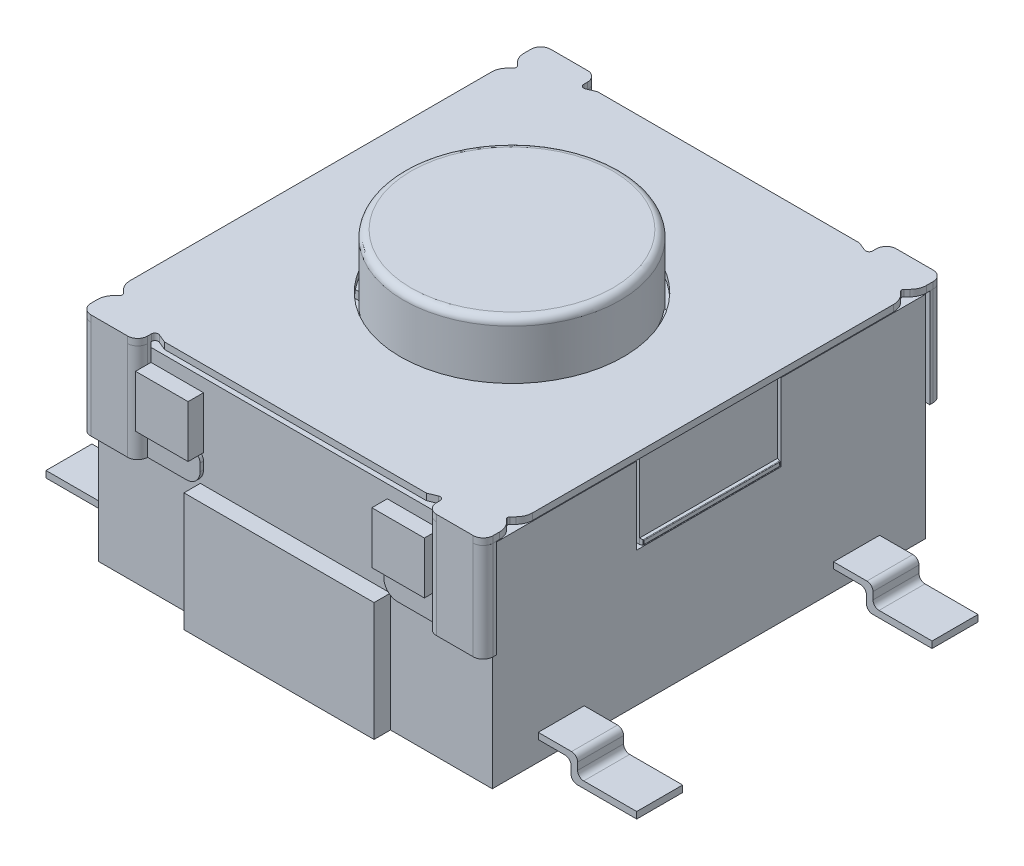
from build123d import *

# Parameters (mm, degrees)
SALIENTE_EXTRUIR1_DEPTH       = 5.2
CROQUIS2_W                    = 9
CROQUIS2_H                    = 3.8
CORTAR_EXTRUIR1_DEPTH         = 5.2
SALIENTE_EXTRUIR2_DEPTH       = 0.3
SALIENTE_EXTRUIR2_DEPTH_BACK  = 3
CROQUIS3_W                    = 6
CROQUIS3_H                    = 6.6
CROQUIS4_R                    = 1.65
CORTAR_EXTRUIR2_DEPTH         = 1.3
SALIENTE_EXTRUIR3_DEPTH       = 0.1
CROQUIS6_R                    = 1.7
CORTAR_EXTRUIR3_DEPTH         = 0.1
CORTAR_EXTRUIR4_DEPTH         = 7.1
CROQUIS9_W                    = 2.099652297
CROQUIS9_H                    = 0.087166241
SALIENTE_EXTRUIR4_DEPTH       = 0.05
SALIENTE_EXTRUIR4_TAPER       = 10
REDONDEO1_R                   = 0.01
CROQUIS10_W                   = 2.099652297
CROQUIS10_H                   = 0.106155941
SALIENTE_EXTRUIR5_DEPTH       = 0.05
SALIENTE_EXTRUIR5_TAPER       = 10
REDONDEO2_R                   = 0.01
SALIENTE_EXTRUIR6_DEPTH       = 1.5
CROQUIS12_W                   = 0.052583555
CROQUIS12_H                   = 0.43471288
SALIENTE_EXTRUIR7_DEPTH       = 0.8
REDONDEO4_R                   = 0.21
REDONDEO5_R                   = 0.11
CROQUIS13_W                   = 0.052583555
CROQUIS13_H                   = 0.428873363
SALIENTE_EXTRUIR8_DEPTH       = 0.8
REDONDEO6_R                   = 0.21
REDONDEO7_R                   = 0.11
CROQUIS14_W                   = 0.052583555
CROQUIS14_H                   = 0.428972682
SALIENTE_EXTRUIR9_DEPTH       = 0.8
REDONDEO8_R                   = 0.21
REDONDEO9_R                   = 0.11
CROQUIS15_W                   = 0.051174265
CROQUIS15_H                   = 0.43615012
SALIENTE_EXTRUIR10_DEPTH      = 0.8
REDONDEO10_R                  = 0.11
REDONDEO11_R                  = 0.21
SALIENTE_EXTRUIR11_DEPTH      = 0.23
SALIENTE_EXTRUIR11_DEPTH_BACK = 6.835
CROQUIS16_W                   = 0.8
CROQUIS16_H                   = 0.791126244
SALIENTE_EXTRUIR12_DEPTH      = 0.23
SALIENTE_EXTRUIR12_DEPTH_BACK = 6.85
CROQUIS17_W                   = 2.89647861
CROQUIS17_H                   = 1.806507962
CROQUIS18_R                   = 1.65
CORTAR_EXTRUIR5_DEPTH         = 2.23
CROQUIS19_R                   = 1.65
SALIENTE_EXTRUIR13_DEPTH      = 2.23
REDONDEO12_R                  = 0.11


with BuildPart() as part:
    # Croquis1 → Saliente-Extruir1 (new body)
    with BuildSketch(Plane.XY):
        with BuildLine():
            Line((0, 0), (0.907509214, 0))
            ThreePointArc((0.907509214, 0), (0.972910076, 0.027089924), (1, 0.092490786))
            Line((1, 0.092490786), (1, 0.20688219))
            ThreePointArc((1, 0.20688219), (1.027089924, 0.272283052), (1.092490786, 0.299372976))
            Line((1.092490786, 0.299372976), (7.907509214, 0.299372976))
            ThreePointArc((7.907509214, 0.299372976), (7.972910076, 0.272283052), (8, 0.20688219))
            Line((8, 0.20688219), (8, 0.092490786))
            ThreePointArc((8, 0.092490786), (8.027089924, 0.027089924), (8.092490786, 0))
            Line((8.092490786, 0), (9, 0))
            Line((9, 0), (9, 0.1))
            Line((9, 0.1), (8.192490786, 0.1))
            ThreePointArc((8.192490786, 0.1), (8.127089924, 0.127089924), (8.1, 0.192490786))
            Line((8.1, 0.192490786), (8.1, 0.299372976))
            Line((8.1, 0.299372976), (8.1, 0.30214365))
            ThreePointArc((8.1, 0.30214365), (8.072910076, 0.367544511), (8.007509214, 0.394634435))
            Line((8.007509214, 0.394634435), (0.992490786, 0.394634435))
            ThreePointArc((0.992490786, 0.394634435), (0.927089924, 0.367544511), (0.9, 0.30214365))
            Line((0.9, 0.30214365), (0.9, 0.299372976))
            Line((0.9, 0.299372976), (0.9, 0.192490786))
            ThreePointArc((0.9, 0.192490786), (0.872910076, 0.127089924), (0.807509214, 0.1))
            Line((0.807509214, 0.1), (0, 0.1))
            Line((0, 0.1), (0, 0))
        make_face()
    extrude(amount=SALIENTE_EXTRUIR1_DEPTH)

    # Croquis2 → Cortar-Extruir1 (cut)
    with BuildSketch(Plane(origin=(0, 0.394634435, 0), x_dir=(1, 0, 0), z_dir=(0, 1, 0))):
        with Locations((4.5, -2.6)):
            Rectangle(CROQUIS2_W, CROQUIS2_H)
    extrude(amount=-CORTAR_EXTRUIR1_DEPTH, mode=Mode.SUBTRACT)


with BuildPart() as cortar_extruir1_piece_1:
    # of the separate pieces the step leaves, piece 1, a body of its own (cortar_extruir1_pieces)
    add(part.part.solids().sort_by_distance((0.9, 0.30214365, 4.5))[0])



with BuildPart() as cortar_extruir1_piece_2:
    # of the separate pieces the step leaves, piece 2, a body of its own (cortar_extruir1_pieces)
    add(part.part.solids().sort_by_distance((0.992490786, 0.394634435, 0))[0])


with BuildPart() as cortar_extruir1_piece_1_1:
    add(cortar_extruir1_piece_1.part)

    add(cortar_extruir1_piece_2.part)  # Saliente-Extruir2 merges Cortar-Extruir1 piece 2
    # Croquis3 → Saliente-Extruir2 (add, two sides: drawn at the far end of the back side and taken through both)
    with BuildSketch(Plane.XZ.offset(-0.299372976).offset(-SALIENTE_EXTRUIR2_DEPTH_BACK)):
        with Locations((4.5, 2.6)):
            Rectangle(CROQUIS3_W, CROQUIS3_H)
    extrude(amount=SALIENTE_EXTRUIR2_DEPTH + SALIENTE_EXTRUIR2_DEPTH_BACK)

    # Croquis4 → Cortar-Extruir2 (cut)
    with BuildSketch(Plane(origin=(0, 3.299372976, 0), x_dir=(1, 0, 0), z_dir=(0, 1, 0))):
        with Locations(Location((4.5, -2.6, 0), (0, 0, 270))):
            Circle(CROQUIS4_R)
    extrude(amount=-CORTAR_EXTRUIR2_DEPTH, mode=Mode.SUBTRACT)

    # Croquis5 → Saliente-Extruir3 (add)
    with BuildSketch(Plane(origin=(0, 3.299372976, 0), x_dir=(1, 0, 0), z_dir=(0, 1, 0))):
        with BuildLine():
            Line((2.504716132, -5.9), (2.373359986, -5.845328176))
            ThreePointArc((2.373359986, -5.845328176), (2.323590515, -5.850165849), (2.3, -5.894255427))
            Line((2.3, -5.894255427), (2.3, -5.951019444))
            ThreePointArc((2.3, -5.951019444), (2.255390439, -6.058716451), (2.147693433, -6.103326011))
            Line((2.147693433, -6.103326011), (1.587427805, -6.103326011))
            ThreePointArc((1.587427805, -6.103326011), (1.479730799, -6.058716451), (1.435121238, -5.951019444))
            Line((1.435121238, -5.951019444), (1.435121238, -5.852924356))
            ThreePointArc((1.435121238, -5.852924356), (1.454499263, -5.755504449), (1.509683207, -5.672915841))
            Line((1.509683207, -5.672915841), (1.553576638, -5.629022409))
            ThreePointArc((1.553576638, -5.629022409), (1.564925448, -5.60162396), (1.553576638, -5.574225511))
            Line((1.553576638, -5.574225511), (1.509683207, -5.530332079))
            ThreePointArc((1.509683207, -5.530332079), (1.454499263, -5.44774347), (1.435121238, -5.350323564))
            Line((1.435121238, -5.350323564), (1.435121238, -3.103211445))
            Line((1.435121238, -3.103211445), (1.435121238, -2.096788555))
            Line((1.435121238, -2.096788555), (1.435121238, 0.150323564))
            ThreePointArc((1.435121238, 0.150323564), (1.454499263, 0.24774347), (1.509683207, 0.330332079))
            Line((1.509683207, 0.330332079), (1.553576638, 0.374225511))
            ThreePointArc((1.553576638, 0.374225511), (1.564925448, 0.40162396), (1.553576638, 0.429022409))
            Line((1.553576638, 0.429022409), (1.509683207, 0.472915841))
            ThreePointArc((1.509683207, 0.472915841), (1.454499263, 0.555504449), (1.435121238, 0.652924356))
            Line((1.435121238, 0.652924356), (1.435121238, 0.751019444))
            ThreePointArc((1.435121238, 0.751019444), (1.479730799, 0.858716451), (1.587427805, 0.903326011))
            Line((1.587427805, 0.903326011), (2.147693433, 0.903326011))
            ThreePointArc((2.147693433, 0.903326011), (2.255390439, 0.858716451), (2.3, 0.751019444))
            Line((2.3, 0.751019444), (2.3, 0.694255427))
            ThreePointArc((2.3, 0.694255427), (2.323590515, 0.650165849), (2.373359986, 0.645328176))
            Line((2.373359986, 0.645328176), (2.504716132, 0.7))
            Line((2.504716132, 0.7), (6.495283868, 0.7))
            Line((6.495283868, 0.7), (6.626640014, 0.645328176))
            ThreePointArc((6.626640014, 0.645328176), (6.676409485, 0.650165849), (6.7, 0.694255427))
            Line((6.7, 0.694255427), (6.7, 0.751019444))
            ThreePointArc((6.7, 0.751019444), (6.744609561, 0.858716451), (6.852306567, 0.903326011))
            Line((6.852306567, 0.903326011), (7.412572195, 0.903326011))
            ThreePointArc((7.412572195, 0.903326011), (7.520269201, 0.858716451), (7.564878762, 0.751019444))
            Line((7.564878762, 0.751019444), (7.564878762, 0.652924356))
            ThreePointArc((7.564878762, 0.652924356), (7.545500737, 0.555504449), (7.490316793, 0.472915841))
            Line((7.490316793, 0.472915841), (7.446423362, 0.429022409))
            ThreePointArc((7.446423362, 0.429022409), (7.435074552, 0.40162396), (7.446423362, 0.374225511))
            Line((7.446423362, 0.374225511), (7.490316793, 0.330332079))
            ThreePointArc((7.490316793, 0.330332079), (7.545500737, 0.24774347), (7.564878762, 0.150323564))
            Line((7.564878762, 0.150323564), (7.564878762, -2.096788555))
            Line((7.564878762, -2.096788555), (7.564878762, -3.103211445))
            Line((7.564878762, -3.103211445), (7.564878762, -5.350323564))
            ThreePointArc((7.564878762, -5.350323564), (7.545500737, -5.44774347), (7.490316793, -5.530332079))
            Line((7.490316793, -5.530332079), (7.446423362, -5.574225511))
            ThreePointArc((7.446423362, -5.574225511), (7.435074552, -5.60162396), (7.446423362, -5.629022409))
            Line((7.446423362, -5.629022409), (7.490316793, -5.672915841))
            ThreePointArc((7.490316793, -5.672915841), (7.545500737, -5.755504449), (7.564878762, -5.852924356))
            Line((7.564878762, -5.852924356), (7.564878762, -5.951019444))
            ThreePointArc((7.564878762, -5.951019444), (7.520269201, -6.058716451), (7.412572195, -6.103326011))
            Line((7.412572195, -6.103326011), (6.852306567, -6.103326011))
            ThreePointArc((6.852306567, -6.103326011), (6.744609561, -6.058716451), (6.7, -5.951019444))
            Line((6.7, -5.951019444), (6.7, -5.894255427))
            ThreePointArc((6.7, -5.894255427), (6.676409485, -5.850165849), (6.626640014, -5.845328176))
            Line((6.626640014, -5.845328176), (6.495283868, -5.9))
            Line((6.495283868, -5.9), (2.504716132, -5.9))
        make_face()
    extrude(amount=SALIENTE_EXTRUIR3_DEPTH)

    # Croquis6 → Cortar-Extruir3 (cut)
    with BuildSketch(Plane(origin=(0, 3.399372976, 0), x_dir=(1, 0, 0), z_dir=(0, 1, 0))):
        with Locations(Location((4.5, -2.6, 0), (0, 0, 270))):
            Circle(CROQUIS6_R)
    extrude(amount=-CORTAR_EXTRUIR3_DEPTH, mode=Mode.SUBTRACT)

    # Croquis7 → Cortar-Extruir4 (cut)
    with BuildSketch(Plane(origin=(7.5, 0, 0), x_dir=(0, 0, -1), z_dir=(1, 0, 0))):
        Polygon((-5.9, 3.299372976), (-3.655372069, 3.299372976), (-3.655372069, 2.100165367), (-1.555719772, 2.100165367), (-1.555719772, 3.299372976), (0.7, 3.299372976), (0.7, 3.224184785), (-1.5, 3.224184785), (-1.5, 2.049372976), (-3.7, 2.049372976), (-3.7, 3.224184785), (-5.9, 3.224184785), align=None)
    extrude(amount=-CORTAR_EXTRUIR4_DEPTH, mode=Mode.SUBTRACT)


with BuildPart() as cortar_extruir4_piece_1:
    # of the separate pieces the step leaves, piece 1, a body of its own (cortar_extruir4_pieces)
    add(cortar_extruir1_piece_1_1.part.solids().sort_by_distance((0.992490786, 0.394634435, 0))[0])



with BuildPart() as cortar_extruir4_piece_2:
    # of the separate pieces the step leaves, piece 2, a body of its own (cortar_extruir4_pieces)
    add(cortar_extruir1_piece_1_1.part.solids().sort_by_distance((1.435121238, 3.299372976, -0.652924356))[0])

    # Croquis9 → Saliente-Extruir4 (add)
    with BuildSketch(Plane(origin=(7.5, 0, 0), x_dir=(0, 0, -1), z_dir=(1, 0, 0))):
        with Locations((-2.605545921, 2.143748487)):
            Rectangle(CROQUIS9_W, CROQUIS9_H)
    extrude(amount=SALIENTE_EXTRUIR4_DEPTH, taper=SALIENTE_EXTRUIR4_TAPER)

    # Redondeo1
    # the kernel refuses this fillet: 0.01 mm, written as the material it takes off along each edge
    with BuildSketch(Plane(origin=(7.55, 2.088004225, 1.564536121), x_dir=(-0.984807753012213, 0, -0.1736481776669017), z_dir=(0, 1, 0)), Plane(origin=(7.55, 2.19949275, 3.64655572), x_dir=(-0.9848077530122086, 0, 0.17364817766692736), z_dir=(0, -1, 0))) as redondeo1_piece_1:
        with BuildLine():
            CenterArc((REDONDEO1_R * 0.839099631177, REDONDEO1_R), REDONDEO1_R, 190, 80)
            Line((-REDONDEO1_R * 0.145708121835, REDONDEO1_R * 0.826351822333), (0, 0))
            Line((0, 0), (REDONDEO1_R * 0.839099631177, 0))
        make_face()
    extrude(amount=0.111488525, mode=Mode.SUBTRACT)
    with BuildSketch(Plane(origin=(7.55, 2.178515259, 1.543558631), x_dir=(-0.9848077530122086, 0.17364817766692736, 0), z_dir=(0, 0, 1)), Plane(origin=(7.55, 2.108981716, 3.66753321), x_dir=(-0.9848077530122086, -0.17364817766692736, 0), z_dir=(0, 0, -1))) as redondeo1_piece_2:
        with BuildLine():
            CenterArc((REDONDEO1_R * 0.839099631177, REDONDEO1_R), REDONDEO1_R, 190, 80)
            Line((-REDONDEO1_R * 0.145708121835, REDONDEO1_R * 0.826351822333), (0, 0))
            Line((0, 0), (REDONDEO1_R * 0.839099631177, 0))
        make_face()
    extrude(amount=2.12397458, mode=Mode.SUBTRACT)

    # Croquis10 → Saliente-Extruir5 (add)
    with BuildSketch(Plane.ZY.offset(-1.5)):
        with Locations((2.605545921, 2.153243338)):
            Rectangle(CROQUIS10_W, CROQUIS10_H)
    extrude(amount=SALIENTE_EXTRUIR5_DEPTH, taper=SALIENTE_EXTRUIR5_TAPER)

    # Redondeo2
    # the kernel refuses this fillet: 0.01 mm, written as the material it takes off along each edge
    with BuildSketch(Plane(origin=(1.45, 2.088004225, 3.64655572), x_dir=(0.9848077530122102, 0, 0.1736481776669183), z_dir=(0, 1, 0)), Plane(origin=(1.45, 2.21848245, 1.564536121), x_dir=(0.9848077530122102, 0, -0.1736481776669183), z_dir=(0, -1, 0))) as redondeo2_piece_1:
        with BuildLine():
            CenterArc((REDONDEO2_R * 0.839099631177, REDONDEO2_R), REDONDEO2_R, 190, 80)
            Line((-REDONDEO2_R * 0.145708121835, REDONDEO2_R * 0.826351822333), (0, 0))
            Line((0, 0), (REDONDEO2_R * 0.839099631177, 0))
        make_face()
    extrude(amount=0.130478225, mode=Mode.SUBTRACT)
    with BuildSketch(Plane(origin=(1.45, 2.197504959, 3.66753321), x_dir=(0.9848077530122102, 0.1736481776669183, 0), z_dir=(0, 0, -1)), Plane(origin=(1.45, 2.108981716, 1.543558631), x_dir=(0.9848077530122102, -0.1736481776669183, 0), z_dir=(0, 0, 1))) as redondeo2_piece_2:
        with BuildLine():
            CenterArc((REDONDEO2_R * 0.839099631177, REDONDEO2_R), REDONDEO2_R, 190, 80)
            Line((-REDONDEO2_R * 0.145708121835, REDONDEO2_R * 0.826351822333), (0, 0))
            Line((0, 0), (REDONDEO2_R * 0.839099631177, 0))
        make_face()
    extrude(amount=2.12397458, mode=Mode.SUBTRACT)


with BuildPart() as cortar_extruir4_piece_1_1:
    add(cortar_extruir4_piece_1.part)

    add(cortar_extruir4_piece_2.part)  # Saliente-Extruir6 merges Cortar-Extruir4 piece 2
    # Croquis11 → Saliente-Extruir6 (add)
    with BuildSketch(Plane.XZ.offset(-3.299372976)):
        with BuildLine():
            Line((2.3, 5.9), (2.3, 5.951174265))
            ThreePointArc((2.3, 5.951174265), (2.255435785, 6.058761797), (2.147848254, 6.103326011))
            Line((2.147848254, 6.103326011), (1.587242738, 6.103326011))
            ThreePointArc((1.587242738, 6.103326011), (1.480154625, 6.059258907), (1.435097519, 5.952583555))
            Line((1.435097519, 5.952583555), (1.434610449, 5.9))
            Line((1.434610449, 5.9), (2.3, 5.9))
        make_face()
        with BuildLine():
            Line((7.565389551, 5.9), (6.7, 5.9))
            Line((6.7, 5.9), (6.7, 5.951174265))
            ThreePointArc((6.7, 5.951174265), (6.744564215, 6.058761797), (6.852306567, 6.103326011))
            Line((6.852306567, 6.103326011), (7.412572195, 6.103326011))
            ThreePointArc((7.412572195, 6.103326011), (7.519845375, 6.059258907), (7.564902481, 5.952583555))
            Line((7.564902481, 5.952583555), (7.565389551, 5.9))
        make_face()
        with BuildLine():
            Line((6.7, -0.7), (6.7, -0.751174265))
            ThreePointArc((6.7, -0.751174265), (6.744564215, -0.858761797), (6.852151746, -0.903326011))
            Line((6.852151746, -0.903326011), (7.412757262, -0.903326011))
            ThreePointArc((7.412757262, -0.903326011), (7.519845375, -0.859258907), (7.564902481, -0.752583555))
            Line((7.564902481, -0.752583555), (7.565389551, -0.7))
            Line((7.565389551, -0.7), (6.7, -0.7))
        make_face()
        with BuildLine():
            Line((1.434610449, -0.7), (2.3, -0.7))
            Line((2.3, -0.7), (2.3, -0.751174265))
            ThreePointArc((2.3, -0.751174265), (2.255435785, -0.858761797), (2.147693433, -0.903326011))
            Line((2.147693433, -0.903326011), (1.587427805, -0.903326011))
            ThreePointArc((1.587427805, -0.903326011), (1.480154625, -0.859258907), (1.435097519, -0.752583555))
            Line((1.435097519, -0.752583555), (1.434610449, -0.7))
        make_face()
    extrude(amount=SALIENTE_EXTRUIR6_DEPTH)


with BuildPart() as saliente_extruir7_tool:
    # Croquis12 → Saliente-Extruir7 (new body)
    with BuildSketch(Plane(origin=(2.3, 0, 0), x_dir=(0, 0, -1), z_dir=(1, 0, 0))):
        with Locations((-5.926291778, 2.016729416)):
            Rectangle(CROQUIS12_W, CROQUIS12_H)
    extrude(amount=SALIENTE_EXTRUIR7_DEPTH)


with BuildPart() as cortar_extruir4_piece_1_2:
    add(cortar_extruir4_piece_1_1.part)


with BuildPart() as cortar_extruir4_piece_1_3:
    # Saliente-Extruir7: joined with saliente_extruir7_tool
    add(cortar_extruir4_piece_1_2.part.fuse(saliente_extruir7_tool.part, tol=0.00001))

    # Redondeo4
    redondeo4_edges = [cortar_extruir4_piece_1_3.edges().sort_by_distance(p)[0] for p in [
        (3.1, 1.799372976, 5.926291777),
    ]]
    fillet(redondeo4_edges, radius=REDONDEO4_R)

    # Redondeo5
    redondeo5_edges = [cortar_extruir4_piece_1_3.edges().sort_by_distance(p)[0] for p in [
        (3.1, 2.234085856, 5.926291777),
    ]]
    fillet(redondeo5_edges, radius=REDONDEO5_R)


with BuildPart() as saliente_extruir8_tool:
    # Croquis13 → Saliente-Extruir8 (new body)
    with BuildSketch(Plane.ZY.offset(-6.7)):
        with Locations((5.926291778, 2.013809657)):
            Rectangle(CROQUIS13_W, CROQUIS13_H)
    extrude(amount=SALIENTE_EXTRUIR8_DEPTH)


with BuildPart() as cortar_extruir4_piece_1_4:
    add(cortar_extruir4_piece_1_3.part)


with BuildPart() as cortar_extruir4_piece_1_5:
    # Saliente-Extruir8: joined with saliente_extruir8_tool
    add(cortar_extruir4_piece_1_4.part.fuse(saliente_extruir8_tool.part, tol=0.00001))

    # Redondeo6
    redondeo6_edges = [cortar_extruir4_piece_1_5.edges().sort_by_distance(p)[0] for p in [
        (5.9, 1.799372976, 5.926291777),
    ]]
    fillet(redondeo6_edges, radius=REDONDEO6_R)

    # Redondeo7
    redondeo7_edges = [cortar_extruir4_piece_1_5.edges().sort_by_distance(p)[0] for p in [
        (5.9, 2.228246339, 5.926291777),
    ]]
    fillet(redondeo7_edges, radius=REDONDEO7_R)


with BuildPart() as saliente_extruir9_tool:
    # Croquis14 → Saliente-Extruir9 (new body)
    with BuildSketch(Plane.ZY.offset(-6.7)):
        with Locations((-0.726291778, 2.013859317)):
            Rectangle(CROQUIS14_W, CROQUIS14_H)
    extrude(amount=SALIENTE_EXTRUIR9_DEPTH)


with BuildPart() as cortar_extruir4_piece_1_6:
    add(cortar_extruir4_piece_1_5.part)


with BuildPart() as cortar_extruir4_piece_1_7:
    # Saliente-Extruir9: joined with saliente_extruir9_tool
    add(cortar_extruir4_piece_1_6.part.fuse(saliente_extruir9_tool.part, tol=0.00001))

    # Redondeo8
    redondeo8_edges = [cortar_extruir4_piece_1_7.edges().sort_by_distance(p)[0] for p in [
        (5.9, 1.799372976, -0.726291777),
    ]]
    fillet(redondeo8_edges, radius=REDONDEO8_R)

    # Redondeo9
    redondeo9_edges = [cortar_extruir4_piece_1_7.edges().sort_by_distance(p)[0] for p in [
        (5.9, 2.228345658, -0.726291777),
    ]]
    fillet(redondeo9_edges, radius=REDONDEO9_R)

    # Croquis15 → Saliente-Extruir10 (add)
    with BuildSketch(Plane(origin=(2.3, 0, 0), x_dir=(0, 0, -1), z_dir=(1, 0, 0))):
        with Locations((0.725587133, 2.017448036)):
            Rectangle(CROQUIS15_W, CROQUIS15_H)
    extrude(amount=SALIENTE_EXTRUIR10_DEPTH)

    # Redondeo10
    redondeo10_edges = [cortar_extruir4_piece_1_7.edges().sort_by_distance(p)[0] for p in [
        (3.1, 2.235523096, -0.725587133),
    ]]
    fillet(redondeo10_edges, radius=REDONDEO10_R)

    # Redondeo11
    redondeo11_edges = [cortar_extruir4_piece_1_7.edges().sort_by_distance(p)[0] for p in [
        (3.1, 1.799372976, -0.725587133),
    ]]
    fillet(redondeo11_edges, radius=REDONDEO11_R)

    # Croquis16 → Saliente-Extruir11 (add, two sides: drawn at the far end of the back side and taken through both)
    with BuildSketch(Plane(origin=(0, 0, -0.7), x_dir=(-1, 0, 0), z_dir=(0, 0, -1)).offset(-SALIENTE_EXTRUIR11_DEPTH_BACK)):
        with Locations((-6.3, 2.63037791)):
            Rectangle(CROQUIS16_W, CROQUIS16_H)
        with Locations((-2.7, 2.63037791)):
            Rectangle(CROQUIS16_W, CROQUIS16_H)
    extrude(amount=SALIENTE_EXTRUIR11_DEPTH + SALIENTE_EXTRUIR11_DEPTH_BACK)

    # Croquis17 → Saliente-Extruir12 (add, two sides: drawn at the far end of the back side and taken through both)
    with BuildSketch(Plane(origin=(0, 0, -0.7), x_dir=(-1, 0, 0), z_dir=(0, 0, -1)).offset(-SALIENTE_EXTRUIR12_DEPTH_BACK)):
        with Locations((-4.5, 0.902626957)):
            Rectangle(CROQUIS17_W, CROQUIS17_H)
    extrude(amount=SALIENTE_EXTRUIR12_DEPTH + SALIENTE_EXTRUIR12_DEPTH_BACK)

    # Croquis18 → Cortar-Extruir5 (cut)
    with BuildSketch(Plane(origin=(0, 1.999372976, 0), x_dir=(1, 0, 0), z_dir=(0, 1, 0))):
        with Locations(Location((4.5, -2.6, 0), (0, 0, 270))):
            Circle(CROQUIS18_R)
    extrude(amount=CORTAR_EXTRUIR5_DEPTH, mode=Mode.SUBTRACT)

    # Croquis19 → Saliente-Extruir13 (add)
    with BuildSketch(Plane(origin=(0, 1.999372976, 0), x_dir=(1, 0, 0), z_dir=(0, 1, 0))):
        with Locations(Location((4.5, -2.6, 0), (0, 0, 41.810314896))):
            Circle(CROQUIS19_R)
    extrude(amount=SALIENTE_EXTRUIR13_DEPTH)

    # Redondeo12
    redondeo12_edges = [cortar_extruir4_piece_1_7.edges().sort_by_distance(p)[0] for p in [
        (3.270162612, 4.229372976, 3.7),
    ]]
    fillet(redondeo12_edges, radius=REDONDEO12_R)


solid = cortar_extruir4_piece_1_7.part
